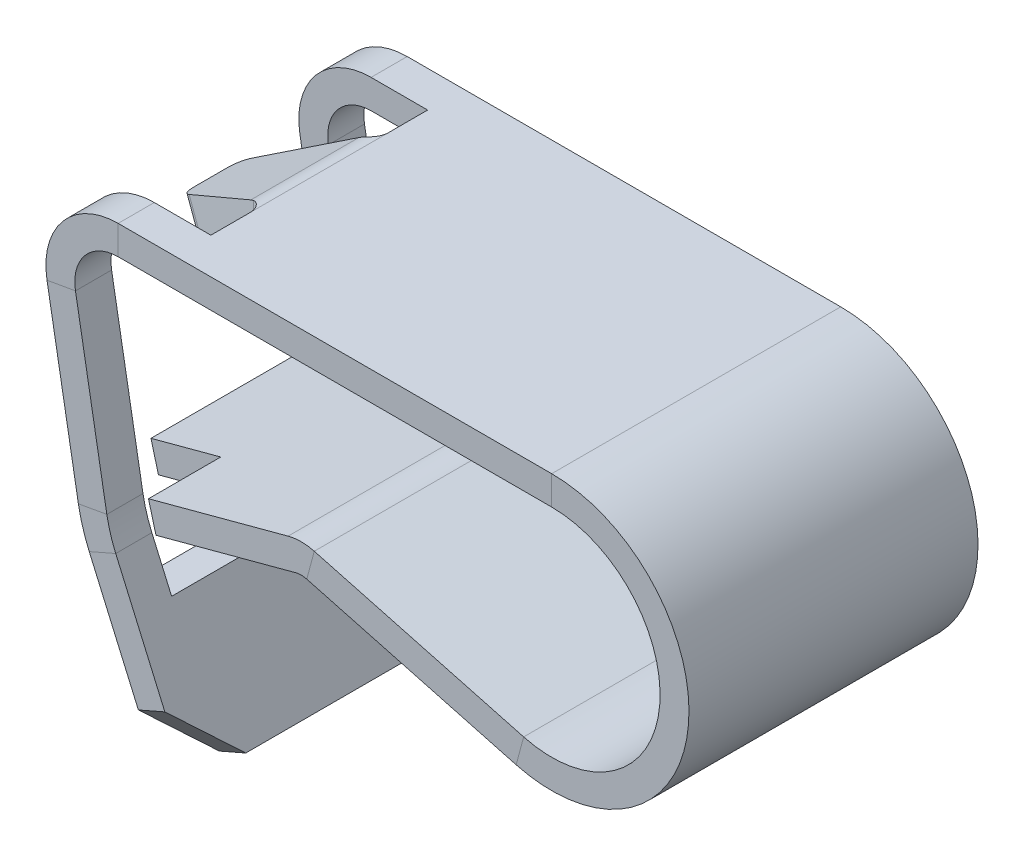
from build123d import *

# Parameters (mm, degrees)
MAINPROFILES_W         = 0.4
MAINPROFILES_H         = 4
CONNECTIONACCESS_REACH = 11.742
CONNECTIONACCESSS_W    = 3
CONNECTIONACCESSS_H    = 4.6
ENDPROFILES_W          = 4
ENDPROFILES_H          = 0.4
ENDCONNECTIONS_W       = 2
ENDCONNECTIONS_H       = 0.4
LOCKINGTABS_W          = 1.6
LOCKINGTABS_H          = 0.4
LTCUT_REACH            = 10.24
LTCUTF_R               = 0.2
MPC_SIZE               = 0.8


with BuildPart() as part:
    # MainProfile: sweep along a path in MainProfilePath
    with BuildLine(Plane.XY) as mainprofile_path:
        Line((0, 0), (-1, 2.291287847))
        ThreePointArc((-1, 2.291287847), (-1.081718762, 2.513588866), (-1.136585228, 2.743991492))
        Line((-1.136585228, 2.743991492), (-1.570705672, 5.206010875))
        ThreePointArc((-1.570705672, 5.206010875), (-1.395695024, 5.859159505), (-0.78285947, 6.144929417))
        Line((-0.78285947, 6.144929417), (5.21714053, 6.144929417))
        ThreePointArc((5.21714053, 6.144929417), (6.902596795, 4.22303489), (4.777148154, 2.802855512))
        Line((4.777148154, 2.802855512), (1.879370675, 3.579312647))
        ThreePointArc((1.879370675, 3.579312647), (1.749961152, 3.596349734), (1.62055163, 3.579312647))
    # MainProfileS → MainProfile (sweep)
    with BuildSketch(Plane(origin=(0, 0, 0), x_dir=(0.9165151389911679, 0.4000000000000004, 0), z_dir=(-0.4000000000000004, 0.9165151389911679, 0))):
        Rectangle(MAINPROFILES_W, MAINPROFILES_H)
    sweep(path=mainprofile_path.line)

    # ConnectionAccessS → ConnectionAccess (cut, up to next)
    with BuildSketch(Plane(origin=(0, 0, 0), x_dir=(0, 0, -1), z_dir=(1, 0, 0)), mode=Mode.PRIVATE) as connectionaccess_sk1:
        with Locations((0, 4.044929417)):
            Rectangle(CONNECTIONACCESSS_W, CONNECTIONACCESSS_H)
    connectionaccess_tool1 = extrude(connectionaccess_sk1.sketch, amount=-CONNECTIONACCESS_REACH, mode=Mode.PRIVATE) & part.part
    add(connectionaccess_tool1.solids().sort_by_distance((0, 4.044929, 0))[0], mode=Mode.SUBTRACT)

    # EndProfile: sweep along a path in EndProfilePath
    with BuildLine(Plane.XY) as endprofile_path:
        Line((1.62055163, 3.579312647), (-0.311300023, 3.061674557))
    # EndProfileS → EndProfile (sweep)
    with BuildSketch(Plane(origin=(2.406823416, 0.644906391, 0), x_dir=(0, 0, 1), z_dir=(-0.9659258262890702, -0.2588190451025136, 0))):
        with Locations((0, 3.037920901)):
            Rectangle(ENDPROFILES_W, ENDPROFILES_H)
    sweep(path=endprofile_path.line)

    # EndConnection: sweep along a path in EndConnectionPath
    with BuildLine(Plane.XY) as endconnection_path:
        Line((-0.311300023, 3.061674557), (-1.277225849, 2.802855512))
    # EndConnectionS → EndConnection (sweep)
    with BuildSketch(Plane(origin=(0.474971764, 0.127268301, 0), x_dir=(0, 0, 1), z_dir=(-0.9659258262890702, -0.2588190451025135, 0))):
        with Locations((0, 3.037920901)):
            Rectangle(ENDCONNECTIONS_W, ENDCONNECTIONS_H)
    sweep(path=endconnection_path.line)

    # LockingTab: sweep along a path in LockingTabPath
    with BuildLine(Plane.XY) as lockingtab_path:
        Line((-1.398843786, 5.368246688), (-0.1, 6.118134498))
        ThreePointArc((-0.1, 6.118134498), (-0.051763809, 6.138114582), (0, 6.144929417))
    # LockingTabS → LockingTab (sweep)
    with BuildSketch(Plane.ZY):
        with Locations((0, 6.144929417)):
            Rectangle(LOCKINGTABS_W, LOCKINGTABS_H)
    sweep(path=lockingtab_path.line)

    # LTCutS → LTCut (cut, up to next)
    with BuildSketch(Plane(origin=(2.972464708, 6.344929417, 0), x_dir=(-1, 0, 0), z_dir=(0, -1, 0)), mode=Mode.PRIVATE) as ltcut_sk1:
        Polygon((2.972464708, 0.8), (4.471308495, 0.4), (4.471308495, 0.8), align=None)
    ltcut_tool1 = extrude(ltcut_sk1.sketch, amount=LTCUT_REACH, mode=Mode.PRIVATE) & part.part
    ltcut = ltcut_tool1.solids().sort_by_distance((-0.999229, 6.344929, -0.666667))[0]
    add(ltcut, mode=Mode.SUBTRACT)

    # LTCutHM: LTCut across plane
    add(ltcut.mirror(Plane.XY), mode=Mode.SUBTRACT)

    # LTCutF
    # the kernel refuses this fillet: 0.2 mm, written as the material it adds along each edge
    with BuildSketch(Plane(origin=(0, 5.560866603, 0.8), x_dir=(0, 0, 1), z_dir=(0, 1, 0))) as ltcutf_piece_1_section:
        with BuildLine():
            CenterArc((LTCUTF_R * 0.768125627693, -LTCUTF_R), LTCUTF_R, 90, 75.05757969)
            Line((-LTCUTF_R * 0.198059812329, -LTCUTF_R * 0.742151797585), (0, 0))
            Line((0, 0), (LTCUTF_R * 0.768125627693, 0))
        make_face()
    ltcutf_piece_1 = extrude(amount=1.168125628, mode=Mode.PRIVATE)
    ltcutf_piece_1 = split(ltcutf_piece_1, bisect_by=Plane(origin=(-0.048441187, 5.916961885, 0.804118212), z_dir=(-0.4999999999999946, 0.8660254037844418, 0)), keep=Keep.TOP, mode=Mode.PRIVATE)
    ltcutf_piece_1 = ltcutf_piece_1 & Plane(origin=(0, 5.944929417, 0.804118212), x_dir=(-0.5000000000000254, 0.8660254037844239, 0), z_dir=(0, 0, -1)) * Cylinder(0.4, 3, mode=Mode.PRIVATE)
    add(ltcutf_piece_1)
    with BuildSketch(Plane(origin=(0, 6.728992231, -0.8), x_dir=(0, 0, -1), z_dir=(0, -1, 0))) as ltcutf_piece_2_section:
        with BuildLine():
            CenterArc((LTCUTF_R * 0.768125627693, -LTCUTF_R), LTCUTF_R, 90, 75.05757969)
            Line((-LTCUTF_R * 0.198059812329, -LTCUTF_R * 0.742151797585), (0, 0))
            Line((0, 0), (LTCUTF_R * 0.768125627693, 0))
        make_face()
    ltcutf_piece_2 = extrude(amount=1.168125628, mode=Mode.PRIVATE)
    ltcutf_piece_2 = split(ltcutf_piece_2, bisect_by=Plane(origin=(0.062272653, 5.98088255, -0.82477541), z_dir=(-0.4999999999999946, 0.8660254037844418, 0)), keep=Keep.TOP, mode=Mode.PRIVATE)
    ltcutf_piece_2 = ltcutf_piece_2 & Plane(origin=(0, 5.944929417, -0.82477541), x_dir=(-0.5000000000000254, 0.8660254037844239, 0), z_dir=(0, 0, -1)) * Cylinder(0.4, 3, mode=Mode.PRIVATE)
    add(ltcutf_piece_2)
    # the kernel refuses this fillet: 0.2 mm, written as the material it takes off along each edge
    with BuildSketch(Plane(origin=(-1.101389565, 4.853040863, 0.506069552), x_dir=(0.8293899797947963, 0.5129525340785382, 0.22134127314713234), z_dir=(-0.49560726984934556, 0.8584169719794723, -0.13226388883618956)), Plane(origin=(-1.101389565, 4.853040863, -0.506069552), x_dir=(0.06613194441810266, -0.11454388773545661, 0.9912145396986104), z_dir=(-0.49560726984934556, 0.8584169719794723, 0.13226388883618956))) as ltcutf_2_piece_1:
        with BuildLine():
            CenterArc((LTCUTF_R * 0.796817292686, LTCUTF_R), LTCUTF_R, 192.903114006, 77.096885994)
            Line((-LTCUTF_R * 0.1779317665, LTCUTF_R * 0.776696906389), (0, 0))
            Line((0, 0), (LTCUTF_R * 0.796817292686, 0))
        make_face()
    extrude(amount=1.200362624, mode=Mode.SUBTRACT)

    # MPC
    mpc_edges = [part.edges().sort_by_distance(p)[0] for p in [
        (0, 0, -2),
        (0, 0, 2),
    ]]
    chamfer(mpc_edges, length=MPC_SIZE)


solid = part.part
